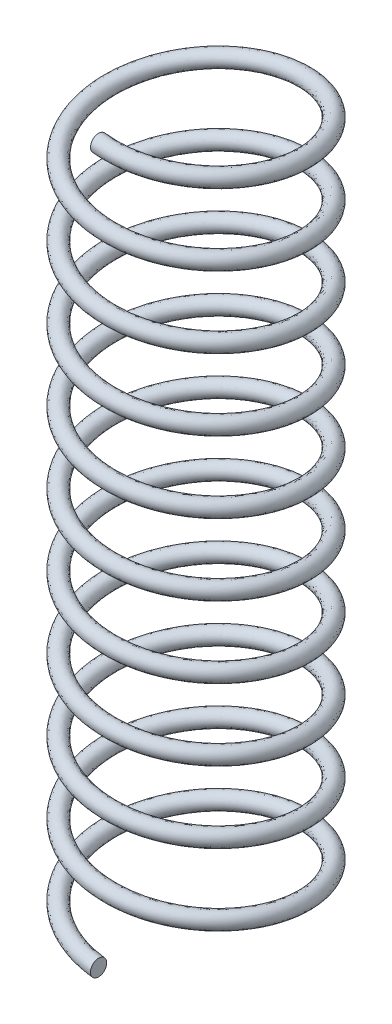
from build123d import *

# Parameters (mm, degrees)
SWEEP1_PITCH  = 3.3
SWEEP1_HEIGHT = 33
SWEEP1_RADIUS = 4.5
SKETCH2_R     = 0.375


with BuildPart() as part:
    # Sweep1: sweep along a helix
    with BuildLine() as sweep1_path:
        Helix(SWEEP1_PITCH, SWEEP1_HEIGHT, SWEEP1_RADIUS, center=(0, 0, 0), direction=(0, 1, 0), lefthand=True)
    # Sketch2 → Sweep1 (sweep)
    with BuildSketch(Plane(origin=(0, 0, 0), x_dir=(0, 0, -1), z_dir=(1, 0, 0))):
        with Locations((-4.5, 0)):
            Circle(SKETCH2_R)
    sweep(path=sweep1_path.line, is_frenet=True)


solid = part.part
